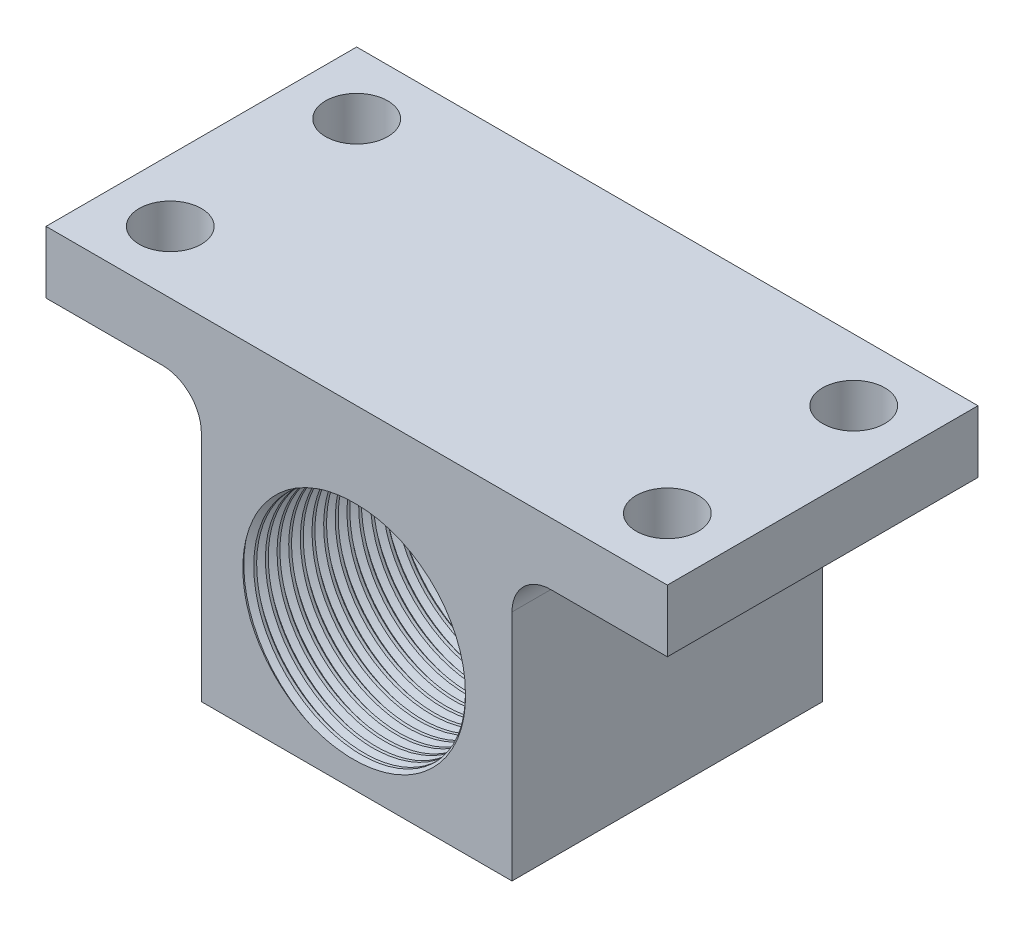
from build123d import *

# Parameters (mm, degrees)
IZIM1_R                     = 14
Y_KSEKLIK_EKSTR_ZYON1_DEPTH = 40
IZIM2_R                     = 4
KES_EKSTR_ZYON1_DEPTH       = 40
RADYUS1_R                   = 5
THREAD1_PITCH               = 1.5


with BuildPart() as part:
    # Çizim1 → Yükseklik-Ekstrüzyon1 (new body)
    with BuildSketch(Plane.XY):
        Polygon((-17.000791994, 10.736842105), (-37.000791994, 10.736842105), (-37.000791994, 18.736842105), (42.999208006, 18.736842105), (42.999208006, 10.736842105), (22.999208006, 10.736842105), (22.999208006, -24.263157895), (-17.000791994, -24.263157895), align=None)
        with Locations((2.999208006, -6.263157895)):
            Circle(IZIM1_R, mode=Mode.SUBTRACT)
    extrude(amount=Y_KSEKLIK_EKSTR_ZYON1_DEPTH)

    # Çizim2 → Kes-Ekstrüzyon1 (cut)
    with BuildSketch(Plane(origin=(0, 18.736842105, 0), x_dir=(1, 0, 0), z_dir=(0, 1, 0))):
        with Locations(Location((-29.000791994, -8, 0), (0, 0, 180))):
            Circle(IZIM2_R)
        with Locations(Location((-29.000791994, -32, 0), (0, 0, 180))):
            Circle(IZIM2_R)
        with Locations(Location((34.999208006, -32, 0), (0, 0, 180))):
            Circle(IZIM2_R)
        with Locations(Location((34.999208006, -8, 0), (0, 0, 180))):
            Circle(IZIM2_R)
    extrude(amount=-KES_EKSTR_ZYON1_DEPTH, mode=Mode.SUBTRACT)

    # Radyus1
    radyus1_edges = [part.edges().sort_by_distance(p)[0] for p in [
        (-17.000791994, 10.736842105, 20),
        (22.999208006, 10.736842105, 20),
    ]]
    fillet(radyus1_edges, radius=RADYUS1_R)

    # Thread1: the profile of Thread Profile1 profile screwed along a right-hand helix of 30 turns, 8 arcs to a turn; built about Z, then put on its axis
    thread1_z = Axis((0, 0, 0), (0, 0, 1))
    thread1_corners = [(13.9997, 0, -0.000173205), (14.811898813, 0, 0.468749998), (14.811898813, 0, 0.656249998), (13.9997, 0, 1.125173201)]
    with BuildLine(mode=Mode.PRIVATE) as thread1_profile:
        Line(thread1_corners[0], thread1_corners[1])
        Line(thread1_corners[1], thread1_corners[2])
        Line(thread1_corners[2], thread1_corners[3])
        Line(thread1_corners[3], thread1_corners[0])
    thread1_cap = Face(thread1_profile.wire())
    thread1_turn_angles = [0, 22.5, 45, 67.5, 90, 112.5, 135, 157.5, 180, 202.5, 225, 247.5, 270, 292.5, 315, 337.5, 360]
    thread1_turn_weights = [1, 0.9238795325112867, 1, 0.9238795325112867, 1, 0.9238795325112867, 1, 0.9238795325112867, 1, 0.9238795325112867, 1, 0.9238795325112867, 1, 0.9238795325112867, 1, 0.9238795325112867, 1]
    thread1_turn_rails = [Edge.make_bspline([Vector(p[0], p[1], 0).rotate(thread1_z, thread1_turn_angles[k]) / thread1_turn_weights[k] + Vector(0, 0, p[2] + THREAD1_PITCH * thread1_turn_angles[k] / 360) for k in range(17)], [0, 0, 0, 1, 1, 2, 2, 3, 3, 4, 4, 5, 5, 6, 6, 7, 7, 8, 8, 8], 2, thread1_turn_weights) for p in thread1_corners]
    thread1_turn_sides = [Face.make_surface_from_curves(thread1_turn_rails[p[0]], thread1_turn_rails[p[1]]) for p in [(0, 1), (1, 2), (2, 3), (3, 0)]]
    thread1 = Plane(origin=(2.999208006, -6.263157895, -5), x_dir=(1, 0, 0), z_dir=(0, 0, 1)) * Solid(Shell([*[p.moved(Location((0, 0, THREAD1_PITCH * i))) for i in range(30) for p in thread1_turn_sides], thread1_cap, thread1_cap.rotate(thread1_z, 10800).moved(Location((0, 0, THREAD1_PITCH * 10800 / 360)))]))
    add(thread1, mode=Mode.SUBTRACT)


solid = part.part
